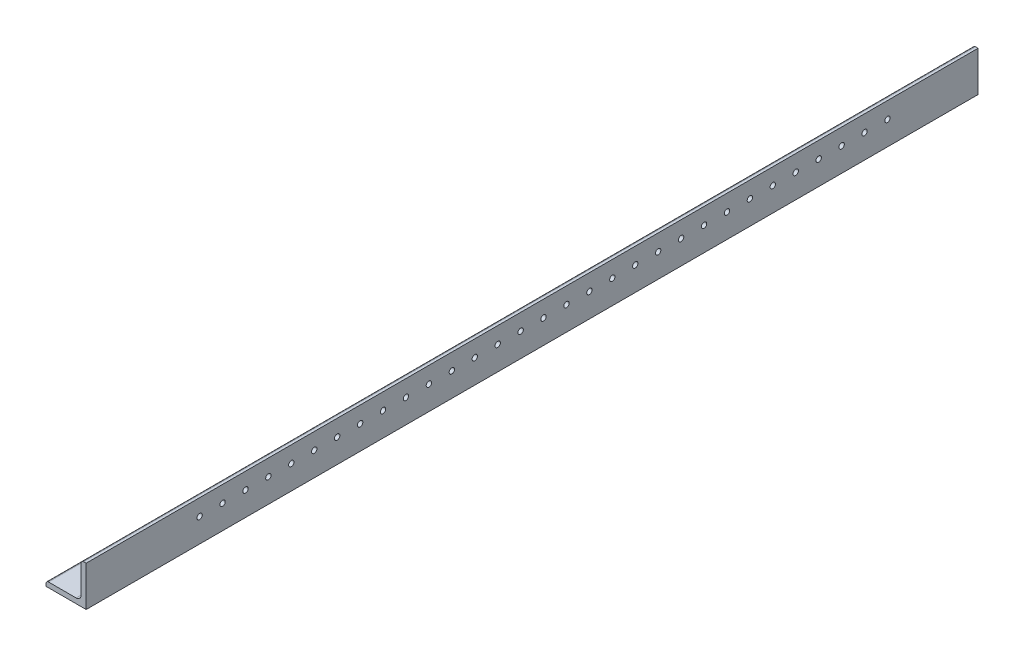
from build123d import *

# Parameters (mm, degrees)
BOSS_EXTRUDE1_DEPTH = 609.6
SKETCH3_W           = 655.2
SKETCH3_H           = 25.4
CUT_EXTRUDE2_DEPTH  = 30.48
SKETCH4_R           = 1.7
CUT_EXTRUDE4_DEPTH  = 611.137198198
SKETCH7_R           = 1.7
CUT_EXTRUDE6_DEPTH  = 611.137198198


with BuildPart() as part:
    # Sketch2 → Boss-Extrude1 (new, symmetric)
    with BuildSketch(Plane.XY):
        with BuildLine():
            Line((-12.7, -12.7), (12.7, -12.7))
            Line((12.7, -12.7), (12.7, 12.7))
            Line((12.7, 12.7), (11.1125, 12.7))
            ThreePointArc((11.1125, 12.7), (9.989967985, 12.235032015), (9.525, 11.1125))
            Line((9.525, 11.1125), (9.525, -6.35))
            ThreePointArc((9.525, -6.35), (8.59506403, -8.59506403), (6.35, -9.525))
            Line((6.35, -9.525), (-11.1125, -9.525))
            ThreePointArc((-11.1125, -9.525), (-12.235032015, -9.989967985), (-12.7, -11.1125))
            Line((-12.7, -11.1125), (-12.7, -12.7))
        make_face()
    extrude(amount=BOSS_EXTRUDE1_DEPTH, both=True)

    # Sketch3 → Cut-Extrude2 (cut)
    with BuildSketch(Plane(origin=(12.7, 0, 0), x_dir=(0, 0, -1), z_dir=(1, 0, 0))):
        with Locations((282, 0)):
            Rectangle(SKETCH3_W, SKETCH3_H)
    extrude(amount=-CUT_EXTRUDE2_DEPTH, mode=Mode.SUBTRACT)

    # Sketch4 → Cut-Extrude4 (cut, through all)
    with BuildSketch(Plane(origin=(0, -9.525, 0), x_dir=(1, 0, 0), z_dir=(0, 1, 0))):
        with Locations((-2.38125, -552.35)):
            Circle(SKETCH4_R)
        with Locations((-2.38125, -537.85)):
            Circle(SKETCH4_R)
        with Locations((-2.38125, -523.35)):
            Circle(SKETCH4_R)
        with Locations((-2.38125, -508.85)):
            Circle(SKETCH4_R)
        with Locations((-2.38125, -494.35)):
            Circle(SKETCH4_R)
        with Locations((-2.38125, -479.85)):
            Circle(SKETCH4_R)
        with Locations((-2.38125, -465.35)):
            Circle(SKETCH4_R)
        with Locations((-2.38125, -450.85)):
            Circle(SKETCH4_R)
        with Locations((-2.38125, -436.35)):
            Circle(SKETCH4_R)
        with Locations((-2.38125, -421.85)):
            Circle(SKETCH4_R)
        with Locations((-2.38125, -407.35)):
            Circle(SKETCH4_R)
        with Locations((-2.38125, -392.85)):
            Circle(SKETCH4_R)
        with Locations((-2.38125, -378.35)):
            Circle(SKETCH4_R)
        with Locations((-2.38125, -363.85)):
            Circle(SKETCH4_R)
        with Locations((-2.38125, -349.35)):
            Circle(SKETCH4_R)
        with Locations((-2.38125, -334.85)):
            Circle(SKETCH4_R)
        with Locations((-2.38125, -320.35)):
            Circle(SKETCH4_R)
        with Locations((-2.38125, -305.85)):
            Circle(SKETCH4_R)
        with Locations((-2.38125, -291.35)):
            Circle(SKETCH4_R)
        with Locations((-2.38125, -276.85)):
            Circle(SKETCH4_R)
        with Locations((-2.38125, -262.35)):
            Circle(SKETCH4_R)
        with Locations((-2.38125, -247.85)):
            Circle(SKETCH4_R)
        with Locations((-2.38125, -233.35)):
            Circle(SKETCH4_R)
        with Locations((-2.38125, -218.85)):
            Circle(SKETCH4_R)
        with Locations((-2.38125, -204.35)):
            Circle(SKETCH4_R)
        with Locations((-2.38125, -189.85)):
            Circle(SKETCH4_R)
        with Locations((-2.38125, -175.35)):
            Circle(SKETCH4_R)
        with Locations((-2.38125, -160.85)):
            Circle(SKETCH4_R)
        with Locations((-2.38125, -146.35)):
            Circle(SKETCH4_R)
        with Locations((-2.38125, -131.85)):
            Circle(SKETCH4_R)
        with Locations((-2.38125, -117.35)):
            Circle(SKETCH4_R)
        with Locations((-2.38125, -102.85)):
            Circle(SKETCH4_R)
    extrude(amount=-CUT_EXTRUDE4_DEPTH, mode=Mode.SUBTRACT)

    # Sketch7 → Cut-Extrude6 (cut, through all)
    with BuildSketch(Plane.ZY.offset(-9.525)):
        with Locations((537.85, 2.38125)):
            Circle(SKETCH7_R)
        with Locations((523.35, 2.38125)):
            Circle(SKETCH7_R)
        with Locations((508.85, 2.38125)):
            Circle(SKETCH7_R)
        with Locations((494.35, 2.38125)):
            Circle(SKETCH7_R)
        with Locations((479.85, 2.38125)):
            Circle(SKETCH7_R)
        with Locations((465.35, 2.38125)):
            Circle(SKETCH7_R)
        with Locations((450.85, 2.38125)):
            Circle(SKETCH7_R)
        with Locations((436.35, 2.38125)):
            Circle(SKETCH7_R)
        with Locations((421.85, 2.38125)):
            Circle(SKETCH7_R)
        with Locations((407.35, 2.38125)):
            Circle(SKETCH7_R)
        with Locations((392.85, 2.38125)):
            Circle(SKETCH7_R)
        with Locations((378.35, 2.38125)):
            Circle(SKETCH7_R)
        with Locations((363.85, 2.38125)):
            Circle(SKETCH7_R)
        with Locations((349.35, 2.38125)):
            Circle(SKETCH7_R)
        with Locations((334.85, 2.38125)):
            Circle(SKETCH7_R)
        with Locations((320.35, 2.38125)):
            Circle(SKETCH7_R)
        with Locations((305.85, 2.38125)):
            Circle(SKETCH7_R)
        with Locations((291.35, 2.38125)):
            Circle(SKETCH7_R)
        with Locations((276.85, 2.38125)):
            Circle(SKETCH7_R)
        with Locations((262.35, 2.38125)):
            Circle(SKETCH7_R)
        with Locations((247.85, 2.38125)):
            Circle(SKETCH7_R)
        with Locations((233.35, 2.38125)):
            Circle(SKETCH7_R)
        with Locations((218.85, 2.38125)):
            Circle(SKETCH7_R)
        with Locations((204.35, 2.38125)):
            Circle(SKETCH7_R)
        with Locations((189.85, 2.38125)):
            Circle(SKETCH7_R)
        with Locations((175.35, 2.38125)):
            Circle(SKETCH7_R)
        with Locations((160.85, 2.38125)):
            Circle(SKETCH7_R)
        with Locations((146.35, 2.38125)):
            Circle(SKETCH7_R)
        with Locations((131.85, 2.38125)):
            Circle(SKETCH7_R)
        with Locations((117.35, 2.38125)):
            Circle(SKETCH7_R)
        with Locations((102.85, 2.38125)):
            Circle(SKETCH7_R)
    extrude(amount=-CUT_EXTRUDE6_DEPTH, mode=Mode.SUBTRACT)


solid = part.part
